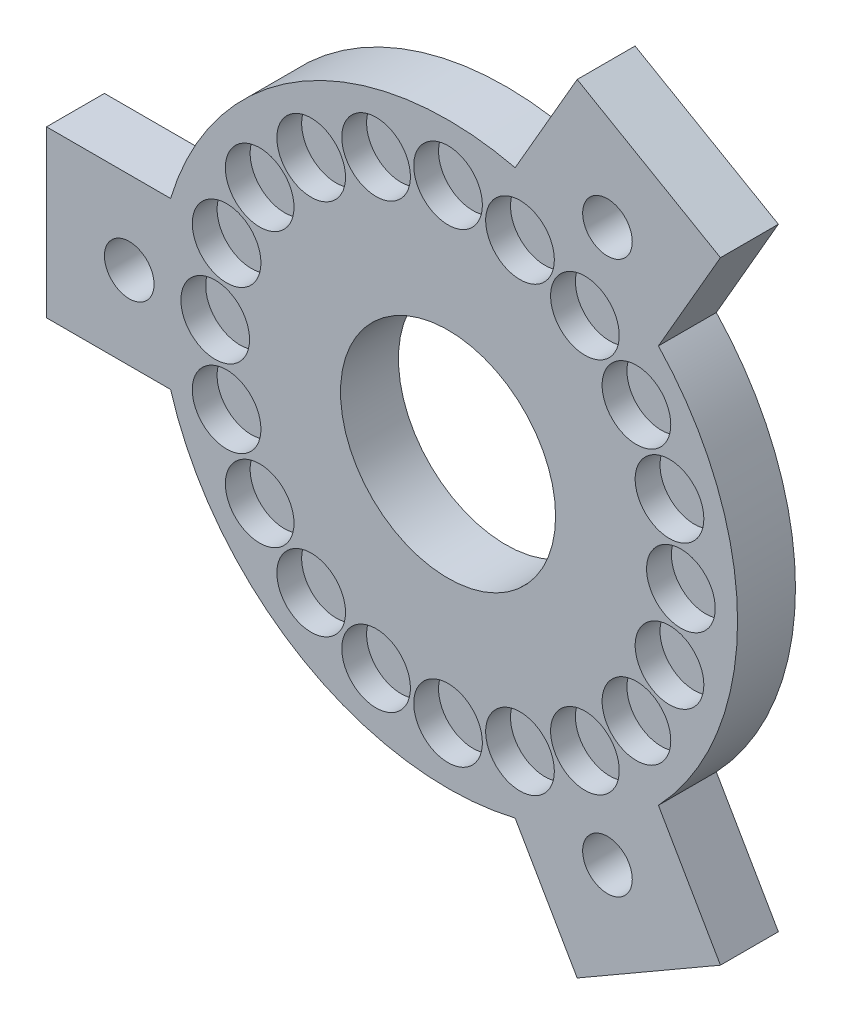
from build123d import *

# Parameters (mm, degrees)
SKIZZE1_R                       = 35
AUFSATZ_LINEAR_AUSTRAGEN3_DEPTH = 7
SKIZZE3_R                       = 4.15
SCHNITT_LINEAR_AUSTRAGEN1_DEPTH = 3
SCHNITT_LINEAR_AUSTRAGEN2_REACH = 51.99
SKIZZE4_R                       = 13
SKIZZE6_W                       = 15
SKIZZE6_H                       = 20
AUFSATZ_LINEAR_AUSTRAGEN4_DEPTH = 7
SCHNITT_LINEAR_AUSTRAGEN5_REACH = 69.954
SKIZZE9_R                       = 3


with BuildPart() as part:
    # Skizze1 → Aufsatz-Linear austragen3 (new body)
    with BuildSketch(Plane.XY):
        Circle(SKIZZE1_R)
    extrude(amount=AUFSATZ_LINEAR_AUSTRAGEN3_DEPTH)

    # Skizze3 → Schnitt-Linear austragen1 (cut)
    with BuildSketch(Plane.XY.offset(7)):
        with Locations((28.15, 0)):
            Circle(SKIZZE3_R)
        with Locations((26.772240934, 8.698828392)):
            Circle(SKIZZE3_R)
        with Locations((26.772240934, -8.698828392)):
            Circle(SKIZZE3_R)
        with Locations((22.773828392, 16.546154852)):
            Circle(SKIZZE3_R)
        with Locations((22.773828392, -16.546154852)):
            Circle(SKIZZE3_R)
        with Locations((16.546154852, 22.773828392)):
            Circle(SKIZZE3_R)
        with Locations((16.546154852, -22.773828392)):
            Circle(SKIZZE3_R)
        with Locations((8.698828392, 26.772240934)):
            Circle(SKIZZE3_R)
        with Locations((8.698828392, -26.772240934)):
            Circle(SKIZZE3_R)
        with Locations((0, 28.15)):
            Circle(SKIZZE3_R)
        with Locations((0, -28.15)):
            Circle(SKIZZE3_R)
        with Locations((-8.698828392, 26.772240934)):
            Circle(SKIZZE3_R)
        with Locations((-8.698828392, -26.772240934)):
            Circle(SKIZZE3_R)
        with Locations((-16.546154852, 22.773828392)):
            Circle(SKIZZE3_R)
        with Locations((-16.546154852, -22.773828392)):
            Circle(SKIZZE3_R)
        with Locations((-22.773828392, 16.546154852)):
            Circle(SKIZZE3_R)
        with Locations((-22.773828392, -16.546154852)):
            Circle(SKIZZE3_R)
        with Locations((-26.772240934, 8.698828392)):
            Circle(SKIZZE3_R)
        with Locations((-26.772240934, -8.698828392)):
            Circle(SKIZZE3_R)
        with Locations((-28.15, 0)):
            Circle(SKIZZE3_R)
    extrude(amount=-SCHNITT_LINEAR_AUSTRAGEN1_DEPTH, mode=Mode.SUBTRACT)

    # Skizze4 → Schnitt-Linear austragen2 (cut, up to next)
    with BuildSketch(Plane.XY.offset(7), mode=Mode.PRIVATE) as schnitt_linear_austragen2_sk1:
        Circle(SKIZZE4_R)
    schnitt_linear_austragen2_tool1 = extrude(schnitt_linear_austragen2_sk1.sketch, amount=-SCHNITT_LINEAR_AUSTRAGEN2_REACH, mode=Mode.PRIVATE) & part.part
    add(schnitt_linear_austragen2_tool1.solids().sort_by_distance((0, 0, 7))[0], mode=Mode.SUBTRACT)

    # Skizze6 → Aufsatz-Linear austragen4 (add)
    with BuildSketch(Plane(origin=(0, 0, 0), x_dir=(-1, 0, 0), z_dir=(0, 0, -1))):
        Polygon((-15.610255793, -47.037756153), (-32.930763869, -37.037756153), (-25.430763869, -24.047375097), (-8.110255793, -34.047375097), align=None)
        with Locations((41.041019662, 0)):
            Rectangle(SKIZZE6_W, SKIZZE6_H)
        Polygon((-32.930763869, 37.037756153), (-15.610255793, 47.037756153), (-8.110255793, 34.047375097), (-25.430763869, 24.047375097), align=None)
    extrude(amount=-AUFSATZ_LINEAR_AUSTRAGEN4_DEPTH)

    # Skizze9 → Schnitt-Linear austragen5 (cut, up to next)
    with BuildSketch(Plane(origin=(0, 0, 0), x_dir=(-1, 0, 0), z_dir=(0, 0, -1)), mode=Mode.PRIVATE) as schnitt_linear_austragen5_sk1:
        with Locations((38.541019662, 0)):
            Circle(SKIZZE9_R)
    schnitt_linear_austragen5_tool1 = extrude(schnitt_linear_austragen5_sk1.sketch, amount=-SCHNITT_LINEAR_AUSTRAGEN5_REACH, mode=Mode.PRIVATE) & part.part
    # Skizze9 → Schnitt-Linear austragen5 (cut, up to next)
    with BuildSketch(Plane(origin=(0, 0, 0), x_dir=(-1, 0, 0), z_dir=(0, 0, -1)), mode=Mode.PRIVATE) as schnitt_linear_austragen5_sk2:
        with Locations((-19.270509831, -33.377502115)):
            Circle(SKIZZE9_R)
    schnitt_linear_austragen5_tool2 = extrude(schnitt_linear_austragen5_sk2.sketch, amount=-SCHNITT_LINEAR_AUSTRAGEN5_REACH, mode=Mode.PRIVATE) & part.part
    # Skizze9 → Schnitt-Linear austragen5 (cut, up to next)
    with BuildSketch(Plane(origin=(0, 0, 0), x_dir=(-1, 0, 0), z_dir=(0, 0, -1)), mode=Mode.PRIVATE) as schnitt_linear_austragen5_sk3:
        with Locations((-19.270509831, 33.377502115)):
            Circle(SKIZZE9_R)
    schnitt_linear_austragen5_tool3 = extrude(schnitt_linear_austragen5_sk3.sketch, amount=-SCHNITT_LINEAR_AUSTRAGEN5_REACH, mode=Mode.PRIVATE) & part.part
    add(schnitt_linear_austragen5_tool1.solids().sort_by_distance((-38.54102, 0, 0))[0], mode=Mode.SUBTRACT)
    add(schnitt_linear_austragen5_tool2.solids().sort_by_distance((19.27051, -33.377502, 0))[0], mode=Mode.SUBTRACT)
    add(schnitt_linear_austragen5_tool3.solids().sort_by_distance((19.27051, 33.377502, 0))[0], mode=Mode.SUBTRACT)


solid = part.part
